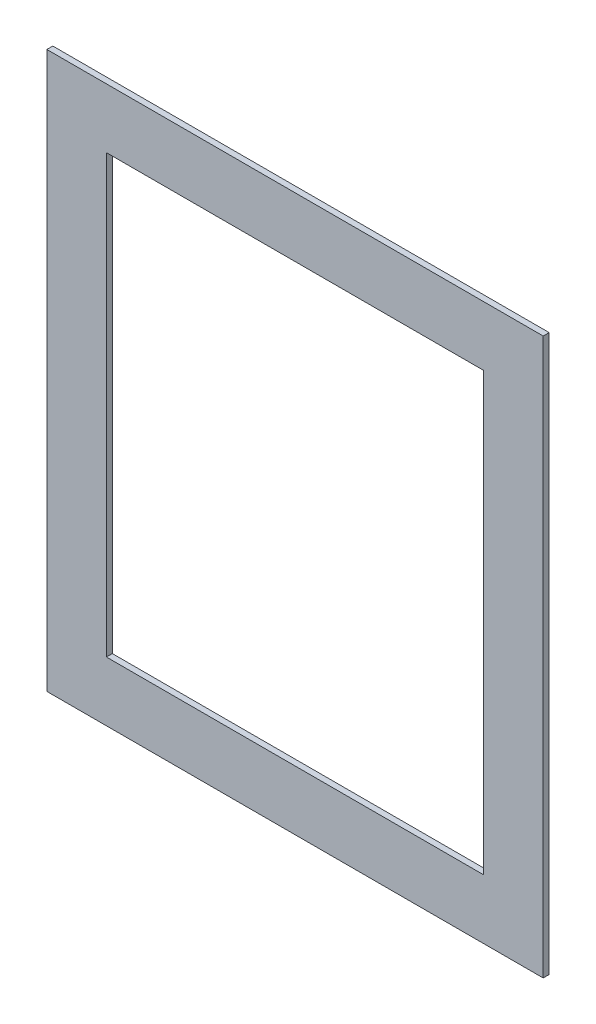
from build123d import *

# Parameters (mm, degrees)
SKETCH_1_W      = 500
SKETCH_1_H      = 560
SKETCH_1_W_2    = 380
SKETCH_1_H_2    = 440
EXTRUDE_1_DEPTH = 6


with BuildPart() as part:
    # Эскиз1 → Бобышка-Вытянуть1 (new body)
    with BuildSketch(Plane.XY):
        with Locations((192.327917168, 260.464227839)):
            Rectangle(SKETCH_1_W, SKETCH_1_H)
        with Locations((192.327917168, 260.464227839)):
            Rectangle(SKETCH_1_W_2, SKETCH_1_H_2, mode=Mode.SUBTRACT)
    extrude(amount=EXTRUDE_1_DEPTH)


solid = part.part
